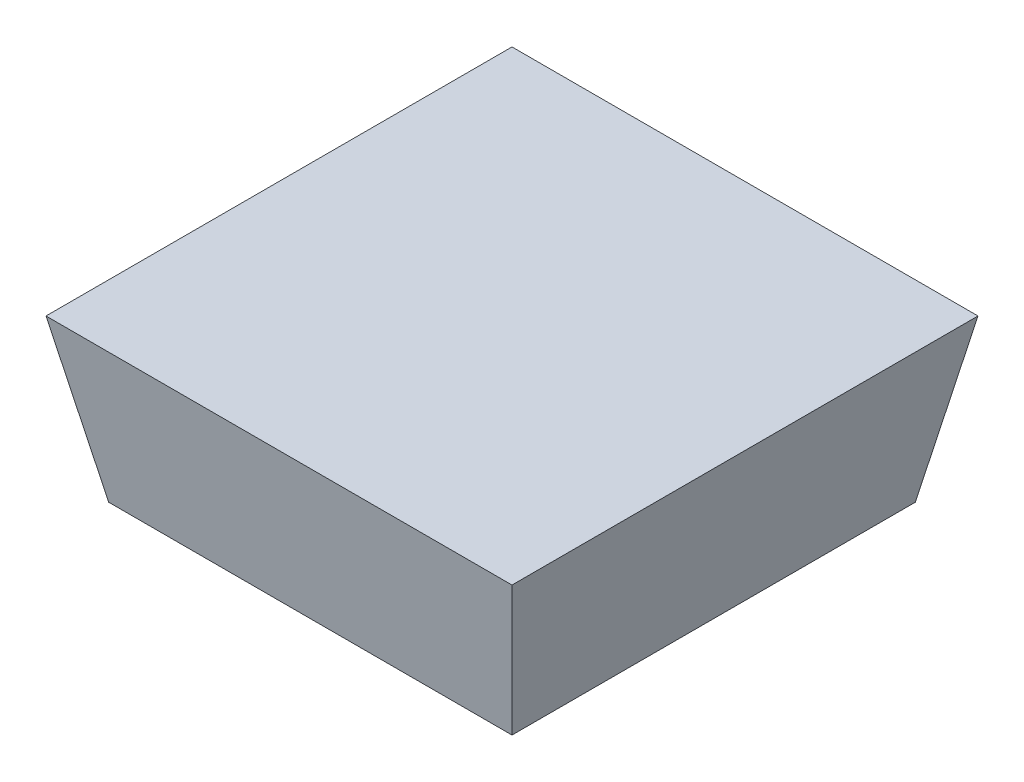
from build123d import *

# Parameters (mm, degrees)
SKETCH1_W           = 25
SKETCH1_H           = 25
BOSS_EXTRUDE1_DEPTH = 10
BOSS_EXTRUDE1_DRAFT = -11
CAVITY1_OUTLINE_W   = 18.62330315
CAVITY1_OUTLINE_H   = 18.62330315
CAVITY1_OUTLINE_W_2 = 14.62330315
CAVITY1_OUTLINE_H_2 = 14.62330315
CAVITY1_DEPTH       = 5.060188455
CAVITY1_DRAFT       = 12


# Read off the part's stored shape, not the designer's step: Cavity1
with BuildPart() as part:
    # Sketch1 → Boss-Extrude1 (with draft: the straight prism first)
    with BuildSketch(Plane(origin=(0, 0, 0), x_dir=(1, 0, 0), z_dir=(0, 1, 0))):
        with Locations((-4.792449363, -1.137627393)):
            Rectangle(SKETCH1_W, SKETCH1_H)
    extrude(amount=BOSS_EXTRUDE1_DEPTH)
    # Boss-Extrude1: the draft: its side faces are tilted about the plane it starts from
    boss_extrude1_sides = [part.faces().sort_by_distance(p)[0] for p in [
        (-17.292449363, 5, 1.137627393),
        (-4.792449363, 5, 13.637627393),
        (7.707550637, 5, 1.137627393),
        (-4.792449363, 5, -11.362372607),
    ]]
    draft(boss_extrude1_sides, Plane(origin=(0, 0, 0), x_dir=(1, 0, 0), z_dir=(0, 1, 0)), BOSS_EXTRUDE1_DRAFT)


with BuildPart() as cavity1_tool:
    # Cavity1 outline → Cavity1 (with draft: the straight prism first)
    with BuildSketch(Plane(origin=(0, 5.060188455, 0), x_dir=(1, 0, 0), z_dir=(0, 1, 0))):
        with Locations((-4.792449363, -1.137627393)):
            Rectangle(CAVITY1_OUTLINE_W, CAVITY1_OUTLINE_H)
        with Locations((-4.792449363, -1.137627393)):
            Rectangle(CAVITY1_OUTLINE_W_2, CAVITY1_OUTLINE_H_2, mode=Mode.SUBTRACT)
    extrude(amount=-CAVITY1_DEPTH)
    # Cavity1: the draft: its side faces are tilted about the plane it starts from
    cavity1_sides = [cavity1_tool.faces().sort_by_distance(p)[0] for p in [
        (-14.104100938, 2.530094227, 1.137627393),
        (-4.792449363, 2.530094227, 10.449278968),
        (4.519202212, 2.530094227, 1.137627393),
        (-4.792449363, 2.530094227, -8.174024182),
        (2.519202212, 2.530094227, 1.137627393),
        (-4.792449363, 2.530094227, 8.449278968),
        (-12.104100938, 2.530094227, 1.137627393),
        (-4.792449363, 2.530094227, -6.174024182),
    ]]
    draft(cavity1_sides, Plane(origin=(0, 5.060188455, 0), x_dir=(1, 0, 0), z_dir=(0, 1, 0)), CAVITY1_DRAFT)


with BuildPart() as part_1:
    add(part.part)

    # Cavity1: cut by cavity1_tool
    add(cavity1_tool.part, mode=Mode.SUBTRACT)


solid = part_1.part
